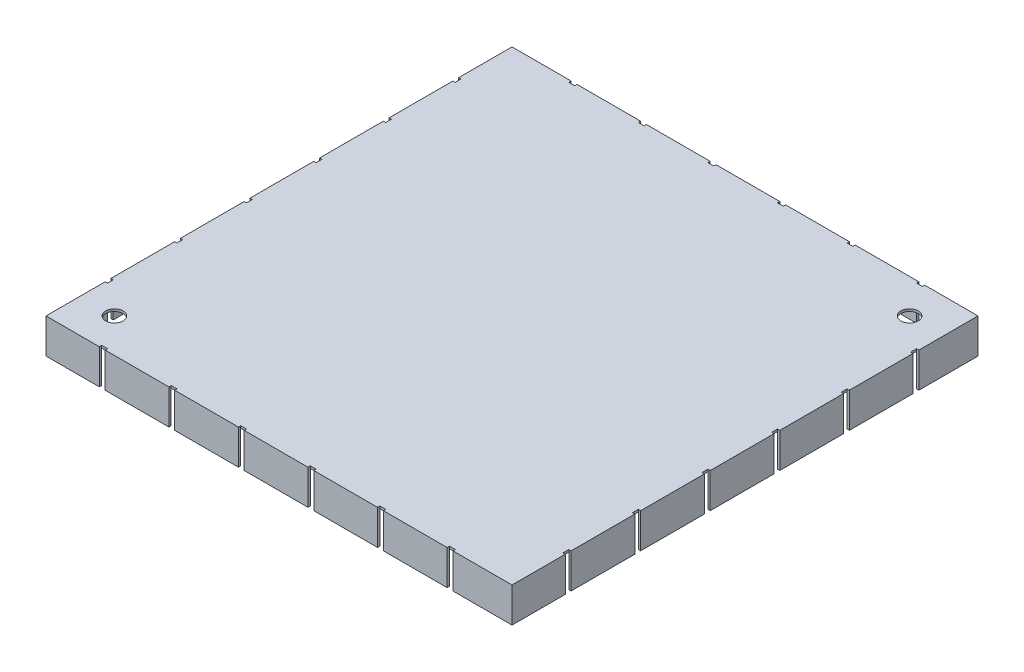
from build123d import *

# Parameters (mm, degrees)
SKETCH1_W               = 40.2
SKETCH1_H               = 40.2
BOSS_EXTRUDE1_DEPTH     = 3
SHELL1_T                = -0.2
SKETCH2_R               = 0.75
HOLES_DEPTH             = 29.583561709
FINGER_START            = 19.9
SKETCH3_W               = 0.5
SKETCH3_H               = 3
FINGER_SLOT_DEPTH       = 0.2
LPATTERN3_COUNT         = 6
LPATTERN3_PITCH         = 6
CIRPATTERN1_START       = -20.1
CIRPATTERN1_OUTLINE_W   = 0.5
CIRPATTERN1_OUTLINE_H   = 3
CIRPATTERN1_DEPTH       = 0.2
CIRPATTERN1_START_2     = 19.9
CIRPATTERN1_2_OUTLINE_W = 0.5
CIRPATTERN1_2_OUTLINE_H = 3
CIRPATTERN1_2_DEPTH     = 0.2
CIRPATTERN1_START_3     = -15.5
CIRPATTERN1_3_OUTLINE_W = 0.2
CIRPATTERN1_3_OUTLINE_H = 3
CIRPATTERN1_3_DEPTH     = 0.5
CIRPATTERN1_START_4     = -9.5
CIRPATTERN1_4_OUTLINE_W = 0.2
CIRPATTERN1_4_OUTLINE_H = 3
CIRPATTERN1_4_DEPTH     = 0.5
CIRPATTERN1_START_5     = -3.5
CIRPATTERN1_5_OUTLINE_W = 0.2
CIRPATTERN1_5_OUTLINE_H = 3
CIRPATTERN1_5_DEPTH     = 0.5
CIRPATTERN1_START_6     = 2.5
CIRPATTERN1_6_OUTLINE_W = 0.2
CIRPATTERN1_6_OUTLINE_H = 3
CIRPATTERN1_6_DEPTH     = 0.5
CIRPATTERN1_START_7     = 8.5
CIRPATTERN1_7_OUTLINE_W = 0.2
CIRPATTERN1_7_OUTLINE_H = 3
CIRPATTERN1_7_DEPTH     = 0.5
CIRPATTERN1_START_8     = 14.5
CIRPATTERN1_8_OUTLINE_W = 0.2
CIRPATTERN1_8_OUTLINE_H = 3
CIRPATTERN1_8_DEPTH     = 0.5


# Read off the part's stored shape, not the designer's step: CirPattern1
with BuildPart() as part:
    # Sketch1 → Boss-Extrude1 (new body)
    with BuildSketch(Plane(origin=(0, 0, 0), x_dir=(1, 0, 0), z_dir=(0, 1, 0))):
        Rectangle(SKETCH1_W, SKETCH1_H)
    extrude(amount=BOSS_EXTRUDE1_DEPTH)

    # Shell1
    shell1_openings = [part.faces().sort_by_distance(p)[0] for p in [
        (0, 0, 0),
    ]]
    offset(amount=SHELL1_T, openings=shell1_openings, kind=Kind.INTERSECTION)

    # Sketch2 → Holes (cut, through all)
    with BuildSketch(Plane(origin=(0, 0, 0), x_dir=(1, 0, 0), z_dir=(0, 1, 0))):
        with Locations(Location((-17.15, -17.15, 0), (0, 0, 90))):
            Circle(SKETCH2_R)
        with Locations(Location((17.15, 17.15, 0), (0, 0, 90))):
            Circle(SKETCH2_R)
    extrude(amount=HOLES_DEPTH, mode=Mode.SUBTRACT)

    # Sketch3 → Finger Slot (cut)
    with BuildSketch(Plane(origin=(0, 0, 0), x_dir=(0, 0, -1), z_dir=(1, 0, 0)).offset(FINGER_START)):
        with Locations((14.75, 1.5)):
            Rectangle(SKETCH3_W, SKETCH3_H)
    finger_slot = extrude(amount=FINGER_SLOT_DEPTH, mode=Mode.SUBTRACT)

    # LPattern3: Finger Slot ×6
    with Locations(*[(0, 0, i * LPATTERN3_PITCH) for i in range(1, LPATTERN3_COUNT)]):
        add(finger_slot, mode=Mode.SUBTRACT)

    # CirPattern1 outline → CirPattern1 (cut)
    with BuildSketch(Plane.XY.offset(CIRPATTERN1_START)):
        with Locations((9.25, 1.5)):
            Rectangle(CIRPATTERN1_OUTLINE_W, CIRPATTERN1_OUTLINE_H)
        with Locations((15.25, 1.5)):
            Rectangle(CIRPATTERN1_OUTLINE_W, CIRPATTERN1_OUTLINE_H)
        with Locations((3.25, 1.5)):
            Rectangle(CIRPATTERN1_OUTLINE_W, CIRPATTERN1_OUTLINE_H)
        with Locations((-2.75, 1.5)):
            Rectangle(CIRPATTERN1_OUTLINE_W, CIRPATTERN1_OUTLINE_H)
        with Locations((-8.75, 1.5)):
            Rectangle(CIRPATTERN1_OUTLINE_W, CIRPATTERN1_OUTLINE_H)
        with Locations((-14.75, 1.5)):
            Rectangle(CIRPATTERN1_OUTLINE_W, CIRPATTERN1_OUTLINE_H)
    extrude(amount=CIRPATTERN1_DEPTH, mode=Mode.SUBTRACT)

    # CirPattern1 2 outline → CirPattern1 2 (cut)
    with BuildSketch(Plane.XY.offset(CIRPATTERN1_START_2)):
        with Locations((14.75, 1.5)):
            Rectangle(CIRPATTERN1_2_OUTLINE_W, CIRPATTERN1_2_OUTLINE_H)
        with Locations((8.75, 1.5)):
            Rectangle(CIRPATTERN1_2_OUTLINE_W, CIRPATTERN1_2_OUTLINE_H)
        with Locations((2.75, 1.5)):
            Rectangle(CIRPATTERN1_2_OUTLINE_W, CIRPATTERN1_2_OUTLINE_H)
        with Locations((-3.25, 1.5)):
            Rectangle(CIRPATTERN1_2_OUTLINE_W, CIRPATTERN1_2_OUTLINE_H)
        with Locations((-9.25, 1.5)):
            Rectangle(CIRPATTERN1_2_OUTLINE_W, CIRPATTERN1_2_OUTLINE_H)
        with Locations((-15.25, 1.5)):
            Rectangle(CIRPATTERN1_2_OUTLINE_W, CIRPATTERN1_2_OUTLINE_H)
    extrude(amount=CIRPATTERN1_2_DEPTH, mode=Mode.SUBTRACT)

    # CirPattern1 3 outline → CirPattern1 3 (cut)
    with BuildSketch(Plane.XY.offset(CIRPATTERN1_START_3)):
        with Locations((-20, 1.5)):
            Rectangle(CIRPATTERN1_3_OUTLINE_W, CIRPATTERN1_3_OUTLINE_H)
    extrude(amount=CIRPATTERN1_3_DEPTH, mode=Mode.SUBTRACT)

    # CirPattern1 4 outline → CirPattern1 4 (cut)
    with BuildSketch(Plane.XY.offset(CIRPATTERN1_START_4)):
        with Locations((-20, 1.5)):
            Rectangle(CIRPATTERN1_4_OUTLINE_W, CIRPATTERN1_4_OUTLINE_H)
    extrude(amount=CIRPATTERN1_4_DEPTH, mode=Mode.SUBTRACT)

    # CirPattern1 5 outline → CirPattern1 5 (cut)
    with BuildSketch(Plane.XY.offset(CIRPATTERN1_START_5)):
        with Locations((-20, 1.5)):
            Rectangle(CIRPATTERN1_5_OUTLINE_W, CIRPATTERN1_5_OUTLINE_H)
    extrude(amount=CIRPATTERN1_5_DEPTH, mode=Mode.SUBTRACT)

    # CirPattern1 6 outline → CirPattern1 6 (cut)
    with BuildSketch(Plane.XY.offset(CIRPATTERN1_START_6)):
        with Locations((-20, 1.5)):
            Rectangle(CIRPATTERN1_6_OUTLINE_W, CIRPATTERN1_6_OUTLINE_H)
    extrude(amount=CIRPATTERN1_6_DEPTH, mode=Mode.SUBTRACT)

    # CirPattern1 7 outline → CirPattern1 7 (cut)
    with BuildSketch(Plane.XY.offset(CIRPATTERN1_START_7)):
        with Locations((-20, 1.5)):
            Rectangle(CIRPATTERN1_7_OUTLINE_W, CIRPATTERN1_7_OUTLINE_H)
    extrude(amount=CIRPATTERN1_7_DEPTH, mode=Mode.SUBTRACT)

    # CirPattern1 8 outline → CirPattern1 8 (cut)
    with BuildSketch(Plane.XY.offset(CIRPATTERN1_START_8)):
        with Locations((-20, 1.5)):
            Rectangle(CIRPATTERN1_8_OUTLINE_W, CIRPATTERN1_8_OUTLINE_H)
    extrude(amount=CIRPATTERN1_8_DEPTH, mode=Mode.SUBTRACT)


solid = part.part
